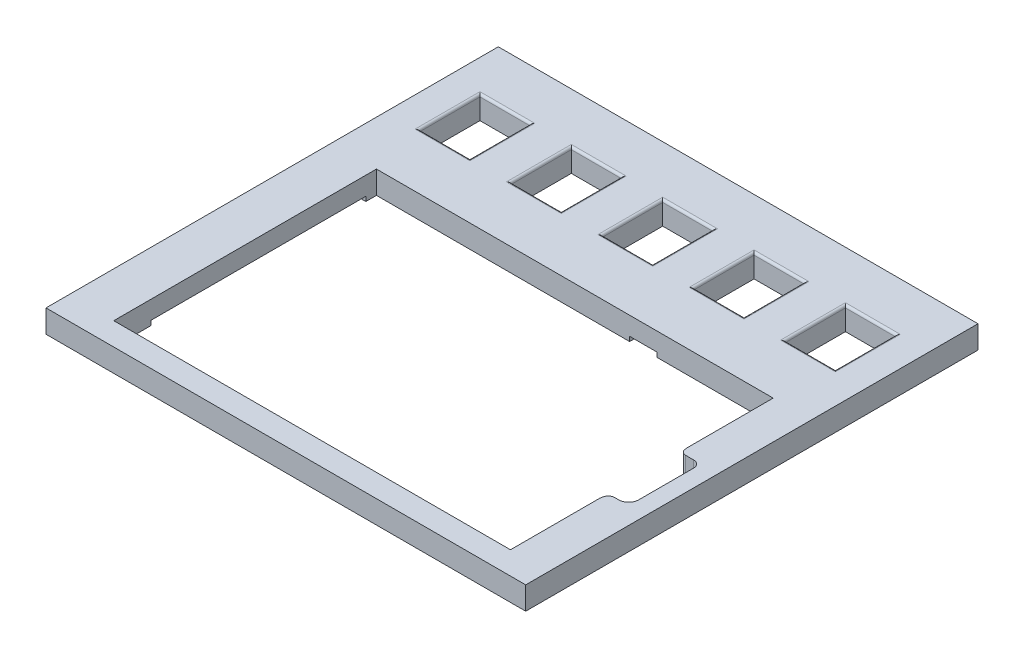
from build123d import *

# Parameters (mm, degrees)
SKETCH1_W           = 105
SKETCH1_H           = 69
BOSS_EXTRUDE1_DEPTH = 5
SKETCH2_W           = 86.836
SKETCH2_H           = 57.499
CUT_EXTRUDE1_DEPTH  = 81.210380614
CUT_EXTRUDE2_DEPTH  = 1
SKETCH4_W           = 5
SKETCH4_H           = 2.165
SKETCH4_H_2         = 0.335
CUT_EXTRUDE3_DEPTH  = 1
CUT_EXTRUDE4_DEPTH  = 81.210380614
SKETCH9_R           = 1
CUT_EXTRUDE7_DEPTH  = 3
SKETCH7_W           = 105
SKETCH7_H           = 30
BOSS_EXTRUDE2_DEPTH = 5
SKETCH8_W           = 11
SKETCH8_H           = 13.2
CUT_EXTRUDE6_DEPTH  = 84.315664794
FILLET1_R           = 0.5
FILLET3_R           = 1


with BuildPart() as part:
    # Sketch1 → Boss-Extrude1 (new body)
    with BuildSketch(Plane(origin=(0, 0, 0), x_dir=(1, 0, 0), z_dir=(0, 1, 0))):
        Rectangle(SKETCH1_W, SKETCH1_H)
    extrude(amount=BOSS_EXTRUDE1_DEPTH)

    # Sketch2 → Cut-Extrude1 (cut, through all)
    with BuildSketch(Plane(origin=(17.072113262, 0, 5.103361153), x_dir=(-1, 0, 0), z_dir=(0, -1, 0))):
        with Locations((16.310113262, 4.341361153)):
            Rectangle(SKETCH2_W, SKETCH2_H)
    extrude(amount=-CUT_EXTRUDE1_DEPTH, mode=Mode.SUBTRACT)

    # Sketch3 → Cut-Extrude2 (cut)
    with BuildSketch(Plane(origin=(17.072113262, 0, 5.103361153), x_dir=(-1, 0, 0), z_dir=(0, -1, 0))):
        Polygon((59.822113262, 30.765861153), (54.524773562, 30.765861153), (54.524773562, -16.234138847), (59.822113262, -16.234138847), (65.822113262, -16.234138847), (65.822113262, 30.765861153), align=None)
    extrude(amount=-CUT_EXTRUDE2_DEPTH, mode=Mode.SUBTRACT)

    # Sketch4 → Cut-Extrude3 (cut)
    with BuildSketch(Plane(origin=(17.072113262, 0, 5.103361153), x_dir=(-1, 0, 0), z_dir=(0, -1, 0))):
        Polygon((-1.187888405, 35.255861153), (3.812111595, 35.255861153), (3.812111595, 33.090861153), (4.312111595, 33.090861153), (4.312111595, 35.755861153), (-1.687888405, 35.755861153), (-1.687888405, 33.090861153), (-1.187888405, 33.090861153), align=None)
        with Locations((1.312111595, 34.173361153)):
            Rectangle(SKETCH4_W, SKETCH4_H)
        Polygon((4.312111595, 33.090861153), (3.812111595, 33.090861153), (3.812111595, 32.755861153), (-1.187888405, 32.755861153), (-1.187888405, 33.090861153), (-1.687888405, 33.090861153), (-1.687888405, 32.255861153), (4.312111595, 32.255861153), align=None)
        with Locations((1.312111595, 32.923361153)):
            Rectangle(SKETCH4_W, SKETCH4_H_2)
    extrude(amount=-CUT_EXTRUDE3_DEPTH, mode=Mode.SUBTRACT)

    # Sketch5 → Cut-Extrude4 (cut, through all)
    with BuildSketch(Plane(origin=(17.072113262, 0, 5.103361153), x_dir=(-1, 0, 0), z_dir=(0, -1, 0))):
        with BuildLine():
            Line((-31.677886738, -0.896638847), (-31.677886738, 11.103361153))
            ThreePointArc((-31.677886738, 11.103361153), (-31.220399504, 12.207833039), (-30.115927617, 12.665320274))
            Line((-30.115927617, 12.665320274), (-28.350143546, 12.665320274))
            ThreePointArc((-28.350143546, 12.665320274), (-27.521232808, 13.008666344), (-27.177886738, 13.837577082))
            Line((-27.177886738, 13.837577082), (-18.865935491, 13.837577082))
            Line((-18.865935491, 13.837577082), (-18.865935491, -4.56597095))
            Line((-18.865935491, -4.56597095), (-27.177886738, -4.56597095))
            ThreePointArc((-27.177886738, -4.56597095), (-27.60841615, -3.526581006), (-28.647806094, -3.096051594))
            Line((-28.647806094, -3.096051594), (-29.478473991, -3.096051594))
            ThreePointArc((-29.478473991, -3.096051594), (-31.033693659, -2.451858515), (-31.677886738, -0.896638847))
        make_face()
    extrude(amount=-CUT_EXTRUDE4_DEPTH, mode=Mode.SUBTRACT)

    # Sketch9 → Cut-Extrude7 (cut)
    with BuildSketch(Plane(origin=(17.072113262, 0, 5.103361153), x_dir=(-1, 0, 0), z_dir=(0, -1, 0))):
        with Locations(Location((-28.677886738, 33.103361153, 0), (0, 0, 90))):
            Circle(SKETCH9_R)
        with Locations(Location((62.822113262, 33.103361153, 0), (0, 0, 90))):
            Circle(SKETCH9_R)
        with Locations(Location((-28.677886738, -22.896638847, 0), (0, 0, 90))):
            Circle(SKETCH9_R)
        with Locations(Location((62.822113262, -22.896638847, 0), (0, 0, 90))):
            Circle(SKETCH9_R)
    extrude(amount=-CUT_EXTRUDE7_DEPTH, mode=Mode.SUBTRACT)

    # Sketch7 → Boss-Extrude2 (add)
    with BuildSketch(Plane(origin=(0, 5, 0), x_dir=(1, 0, 0), z_dir=(0, 1, 0))):
        with Locations((0, 49.5)):
            Rectangle(SKETCH7_W, SKETCH7_H)
    extrude(amount=-BOSS_EXTRUDE2_DEPTH)

    # Sketch8 → Cut-Extrude6 (cut, through all)
    with BuildSketch(Plane(origin=(0, 5, 0), x_dir=(1, 0, 0), z_dir=(0, 1, 0))):
        with Locations((20, 46.886314888)):
            Rectangle(SKETCH8_W, SKETCH8_H)
        with Locations((40, 46.886314888)):
            Rectangle(SKETCH8_W, SKETCH8_H)
        with Locations((0, 46.886314888)):
            Rectangle(SKETCH8_W, SKETCH8_H)
        with Locations((-20, 46.886314888)):
            Rectangle(SKETCH8_W, SKETCH8_H)
        with Locations((-40, 46.886314888)):
            Rectangle(SKETCH8_W, SKETCH8_H)
    extrude(amount=-CUT_EXTRUDE6_DEPTH, mode=Mode.SUBTRACT)

    # Fillet1
    fillet1_edges = [part.edges().sort_by_distance(p)[0] for p in [
        (34.5, 5, -46.886314888),
        (40, 5, -40.286314888),
        (45.5, 5, -46.886314888),
        (40, 5, -53.486314888),
        (20, 5, -53.486314888),
        (14.5, 5, -46.886314888),
        (20, 5, -40.286314888),
        (25.5, 5, -46.886314888),
        (0, 5, -53.486314888),
        (-5.5, 5, -46.886314888),
        (0, 5, -40.286314888),
        (5.5, 5, -46.886314888),
        (-20, 5, -53.486314888),
        (-25.5, 5, -46.886314888),
        (-20, 5, -40.286314888),
        (-14.5, 5, -46.886314888),
        (-40, 5, -53.486314888),
        (-45.5, 5, -46.886314888),
        (-40, 5, -40.286314888),
        (-34.5, 5, -46.886314888),
    ]]
    fillet(fillet1_edges, radius=FILLET1_R)

    # Fillet3
    # the kernel refuses this fillet: 1 mm, written as the material it takes off along each edge
    with BuildSketch(Plane(origin=(44.18, -0.918898797, 9.669332102), x_dir=(0, 0, 1), z_dir=(0, 1, 0)), Plane(origin=(44.18, 5.918898797, -8.734215929), x_dir=(0, 0, -1), z_dir=(0, -1, 0))) as fillet3_piece_1:
        with BuildLine():
            CenterArc((0.367559519, 1), FILLET3_R, 248.434814985, 21.565185015)
            Line((0, 0.07), (-0.00735119, 0.0514))
            ThreePointArc((-0.00735119, 0.0514), (-0.02, 0.035), (-0.02, 0))
            Line((-0.02, 0), (0, -0.02))
            Line((0, -0.02), (0.367559519, -0.02))
            Line((0.367559519, -0.02), (0.367559519, 0))
        make_face()
    extrude(amount=6.837797595, mode=Mode.SUBTRACT)


solid = part.part
